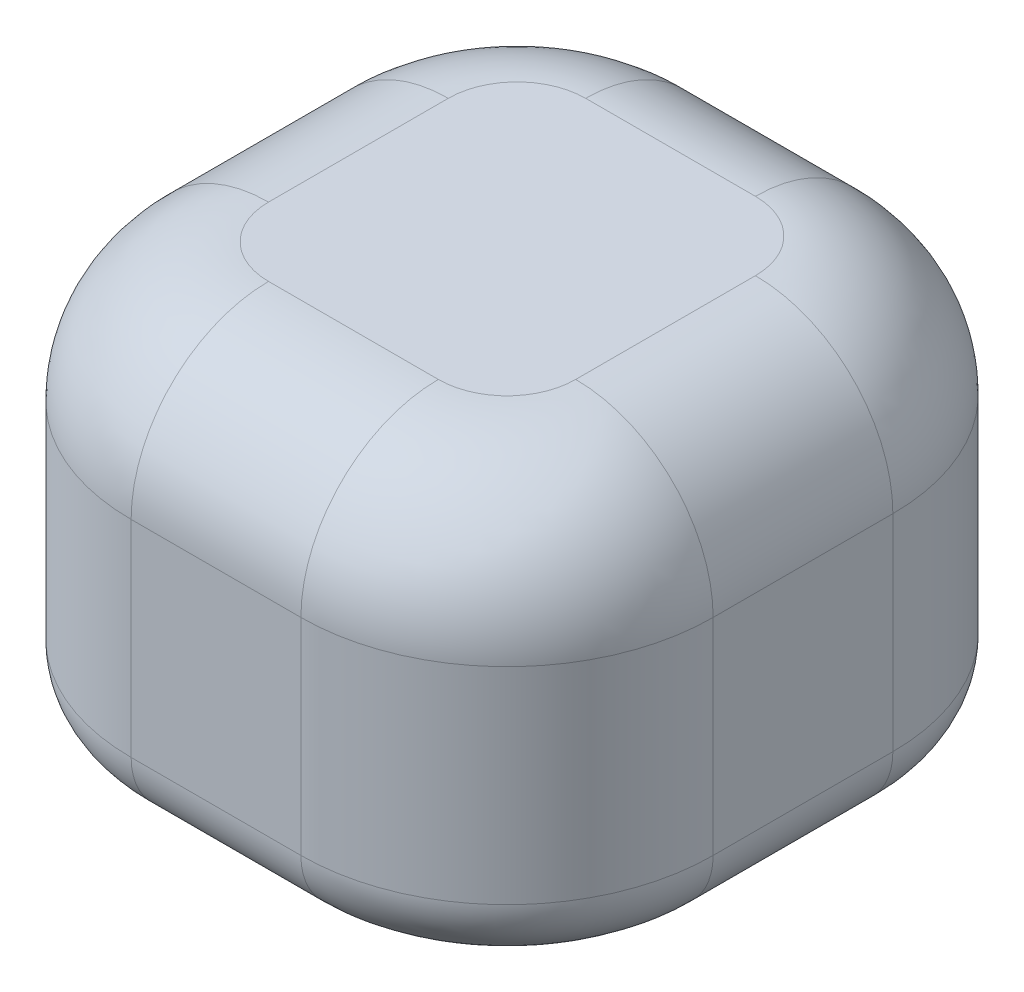
from build123d import *

# Parameters (mm, degrees)
BOSS_EXTRUDE1_DEPTH      = 30
BOSS_EXTRUDE1_DEPTH_BACK = 30
SKETCH1_W                = 84.708364016
SKETCH1_H                = 86.159780402
FILLET1_R                = 30
FILLET2_R                = 20
FILLET3_R                = 10


with BuildPart() as part:
    # Sketch1 → Boss-Extrude1 (new, two sides: drawn at the far end of the back side and taken through both)
    with BuildSketch(Plane(origin=(0, 0, 0), x_dir=(1, 0, 0), z_dir=(0, 1, 0)).offset(-BOSS_EXTRUDE1_DEPTH_BACK)):
        Rectangle(SKETCH1_W, SKETCH1_H)
    extrude(amount=BOSS_EXTRUDE1_DEPTH + BOSS_EXTRUDE1_DEPTH_BACK)

    # Fillet1
    fillet1_edges = [part.edges().sort_by_distance(p)[0] for p in [
        (42.354182008, 0, 43.079890201),
        (42.354182008, 0, -43.079890201),
        (-42.354182008, 0, 43.079890201),
        (-42.354182008, 0, -43.079890201),
    ]]
    fillet(fillet1_edges, radius=FILLET1_R)

    # Fillet2
    fillet2_edges = [part.edges().sort_by_distance(p)[0] for p in [
        (-33.567385444, 30, 34.293093637),
        (-42.354182008, 30, 0),
        (-33.567385444, 30, -34.293093637),
        (0, 30, -43.079890201),
        (33.567385444, 30, -34.293093637),
        (42.354182008, 30, 0),
        (33.567385444, 30, 34.293093637),
        (0, 30, 43.079890201),
    ]]
    fillet(fillet2_edges, radius=FILLET2_R)

    # Fillet3
    fillet3_edges = [part.edges().sort_by_distance(p)[0] for p in [
        (33.567385444, -30, -34.293093637),
        (0, -30, -43.079890201),
        (-33.567385444, -30, -34.293093637),
        (-42.354182008, -30, 0),
        (-33.567385444, -30, 34.293093637),
        (0, -30, 43.079890201),
        (33.567385444, -30, 34.293093637),
        (42.354182008, -30, 0),
    ]]
    fillet(fillet3_edges, radius=FILLET3_R)


solid = part.part
